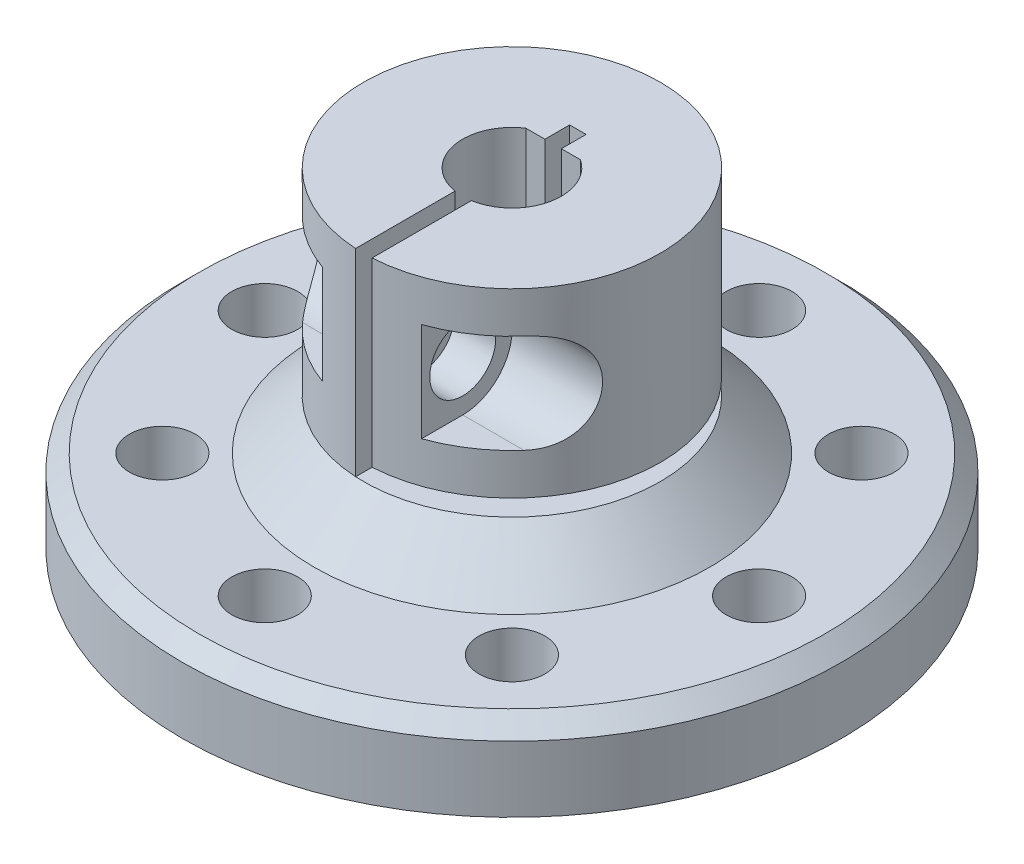
from build123d import *

# Parameters (mm, degrees)
SKETCH1_R           = 20
BOSS_EXTRUDE1_DEPTH = 5
SKETCH2_R           = 2
CUT_EXTRUDE1_DEPTH  = 29.722813233
SKETCH3_R           = 9
BOSS_EXTRUDE2_DEPTH = 15
CUT_EXTRUDE2_DEPTH  = 35.641016151
SKETCH5_W           = 1
SKETCH5_H           = 13
CUT_EXTRUDE3_DEPTH  = 12
CUT_EXTRUDE4_REACH  = 42.509
SKETCH7_W           = 17.986100378
SKETCH7_H           = 1
SKETCH8_R           = 3
CUT_EXTRUDE5_DEPTH  = 6
SKETCH9_R           = 2
CUT_EXTRUDE6_DEPTH  = 37.455452322
CHAMFER3_SIZE       = 3
CHAMFER4_SIZE       = 1


with BuildPart() as part:
    # Sketch1 → Boss-Extrude1 (new body)
    with BuildSketch(Plane(origin=(0, 0, 0), x_dir=(1, 0, 0), z_dir=(0, 1, 0))):
        with Locations(Location((0, 0, 0), (0, 0, 270))):
            Circle(SKETCH1_R)
    extrude(amount=BOSS_EXTRUDE1_DEPTH)

    # Sketch2 → Cut-Extrude1 (cut, through all)
    with BuildSketch(Plane(origin=(0, 5, 0), x_dir=(1, 0, 0), z_dir=(0, 1, 0))):
        with Locations(Location((0, 15, 0), (0, 0, 270))):
            Circle(SKETCH2_R)
        with Locations(Location((10.606601718, 10.606601718, 0), (0, 0, 270))):
            Circle(SKETCH2_R)
        with Locations(Location((15, 0, 0), (0, 0, 270))):
            Circle(SKETCH2_R)
        with Locations(Location((10.606601718, -10.606601718, 0), (0, 0, 270))):
            Circle(SKETCH2_R)
        with Locations(Location((0, -15, 0), (0, 0, 270))):
            Circle(SKETCH2_R)
        with Locations(Location((-10.606601718, -10.606601718, 0), (0, 0, 270))):
            Circle(SKETCH2_R)
        with Locations(Location((-15, 0, 0), (0, 0, 270))):
            Circle(SKETCH2_R)
        with Locations(Location((-10.606601718, 10.606601718, 0), (0, 0, 270))):
            Circle(SKETCH2_R)
    extrude(amount=-CUT_EXTRUDE1_DEPTH, mode=Mode.SUBTRACT)

    # Sketch3 → Boss-Extrude2 (add)
    with BuildSketch(Plane(origin=(0, 5, 0), x_dir=(1, 0, 0), z_dir=(0, 1, 0))):
        with Locations(Location((0, 0, 0), (0, 0, 270))):
            Circle(SKETCH3_R)
    extrude(amount=BOSS_EXTRUDE2_DEPTH)

    # Sketch4 → Cut-Extrude2 (cut, through all)
    with BuildSketch(Plane(origin=(0, 20, 0), x_dir=(1, 0, 0), z_dir=(0, 1, 0))):
        with BuildLine():
            Line((1.658312395, 2.5), (-1.658312395, 2.5))
            ThreePointArc((-1.658312395, 2.5), (-1.418637165, -2.643382037), (3, 0))
            ThreePointArc((3, 0), (2.643382037, 1.418637165), (1.658312395, 2.5))
        make_face()
    extrude(amount=-CUT_EXTRUDE2_DEPTH, mode=Mode.SUBTRACT)

    # Sketch5 → Cut-Extrude3 (cut)
    with BuildSketch(Plane(origin=(0, 20, 0), x_dir=(1, 0, 0), z_dir=(0, 1, 0))):
        with Locations((0, -2.5)):
            Rectangle(SKETCH5_W, SKETCH5_H)
    extrude(amount=-CUT_EXTRUDE3_DEPTH, mode=Mode.SUBTRACT)

    # Cut-Extrude4: up to this face of the body (flat: up to its plane)
    cut_extrude4_end = Plane(part.part.faces().sort_by_distance((-0.5, 14, 5.972070135))[0])
    # Sketch7 → Cut-Extrude4 (cut, up to the picked face)
    with BuildSketch(Plane(origin=(9, 0, 0), x_dir=(0, 0, -1), z_dir=(1, 0, 0)), mode=Mode.PRIVATE) as cut_extrude4_sk1:
        with Locations((0.006949811, 8.5)):
            Rectangle(SKETCH7_W, SKETCH7_H)
    cut_extrude4_tool1 = split(extrude(cut_extrude4_sk1.sketch, amount=-CUT_EXTRUDE4_REACH, mode=Mode.PRIVATE), bisect_by=cut_extrude4_end, keep=Keep.BOTH, mode=Mode.PRIVATE)
    add(cut_extrude4_tool1.solids().sort_by(Axis((9, 8.5, -0.00695), (-1, 0, 0)))[0], mode=Mode.SUBTRACT)

    # Sketch8 → Cut-Extrude5 (cut)
    with BuildSketch(Plane(origin=(9, 0, 0), x_dir=(0, 0, -1), z_dir=(1, 0, 0))):
        with Locations((-5.986100378, 14.5)):
            Circle(SKETCH8_R)
        with BuildLine():
            ThreePointArc((-8.986100378, 14.5), (-8.107420721, 16.621320344), (-5.986100378, 17.5))
            Line((-5.986100378, 17.5), (-8.986100378, 17.5))
            Line((-8.986100378, 17.5), (-8.986100378, 14.5))
        make_face()
        with BuildLine():
            ThreePointArc((-5.986100378, 11.5), (-8.107420721, 12.378679656), (-8.986100378, 14.5))
            Line((-8.986100378, 14.5), (-8.986100378, 11.5))
            Line((-8.986100378, 11.5), (-5.986100378, 11.5))
        make_face()
    cut_extrude5 = extrude(amount=-CUT_EXTRUDE5_DEPTH, mode=Mode.SUBTRACT)

    # Mirror1: Cut-Extrude5 across plane
    add(cut_extrude5.mirror(Plane(origin=(0, 0, 0), x_dir=(0, 0, 1), z_dir=(1, 0, 0))), mode=Mode.SUBTRACT)

    # Sketch9 → Cut-Extrude6 (cut, through all)
    with BuildSketch(Plane(origin=(3, 0, 0), x_dir=(0, 0, -1), z_dir=(1, 0, 0))):
        with Locations(Location((-5.986100378, 14.5, 0), (0, 0, 180))):
            Circle(SKETCH9_R)
    extrude(amount=-CUT_EXTRUDE6_DEPTH, mode=Mode.SUBTRACT)

    # Chamfer3
    chamfer3_edges = [part.edges().sort_by_distance(p)[0] for p in [
        (0, 5, -9),
    ]]
    chamfer(chamfer3_edges, length=CHAMFER3_SIZE - 0.0001)  # a hair under: the kernel refuses the full size

    # Chamfer4
    chamfer4_edges = [part.edges().sort_by_distance(p)[0] for p in [
        (0, 5, -20),
    ]]
    chamfer(chamfer4_edges, length=CHAMFER4_SIZE)


solid = part.part
